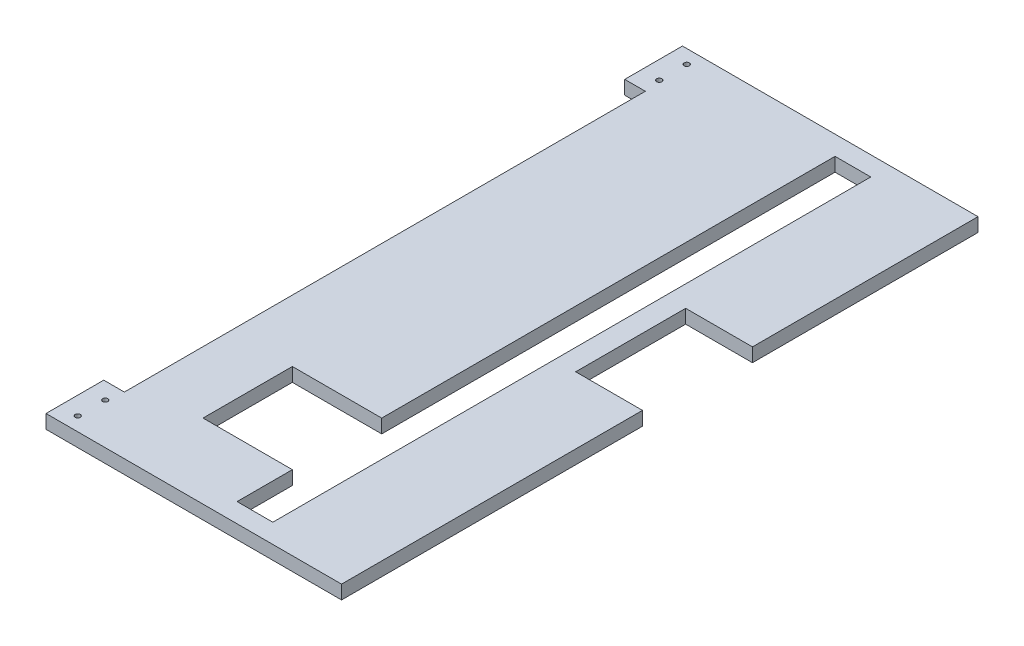
from build123d import *

# Parameters (mm, degrees)
SKETCH1_W           = 430
SKETCH1_H           = 463
BOSS_EXTRUDE1_DEPTH = 10
SKETCH2_W           = 48.6
SKETCH2_H           = 80
CUT_EXTRUDE1_DEPTH  = 10
SKETCH3_R           = 1.9
SKETCH3_W           = 26
SKETCH3_H           = 435
SKETCH3_W_2         = 22.64710068
SKETCH3_H_2         = 40
SKETCH3_W_3         = 30
SKETCH3_H_3         = 379
CUT_EXTRUDE2_DEPTH  = 10
SKETCH4_W           = 65
SKETCH4_H           = 65
CUT_EXTRUDE3_DEPTH  = 10
SKETCH5_W           = 636.219925535
SKETCH5_H           = 371.910781629
CUT_EXTRUDE5_DEPTH  = 255


with BuildPart() as part:
    # Sketch1 → Boss-Extrude1 (new body)
    with BuildSketch(Plane(origin=(0, 0, 0), x_dir=(1, 0, 0), z_dir=(0, 1, 0))):
        with Locations((6126.084066999, -8720.812377786)):
            Rectangle(SKETCH1_W, SKETCH1_H)
    extrude(amount=BOSS_EXTRUDE1_DEPTH)

    # Sketch2 → Cut-Extrude1 (cut)
    with BuildSketch(Plane(origin=(0, 10, 0), x_dir=(1, 0, 0), z_dir=(0, 1, 0))):
        with Locations((5935.384066999, -8693.059787309)):
            Rectangle(SKETCH2_W, SKETCH2_H)
        with Locations((6316.784066999, -8693.384418705)):
            Rectangle(SKETCH2_W, SKETCH2_H)
    extrude(amount=-CUT_EXTRUDE1_DEPTH, mode=Mode.SUBTRACT)

    # Sketch3 → Cut-Extrude2 (cut)
    with BuildSketch(Plane(origin=(0, 10, 0), x_dir=(1, 0, 0), z_dir=(0, 1, 0))):
        with Locations((6112.984066999, -8942.312377786)):
            Circle(SKETCH3_R)
        with Locations((6139.184066999, -8942.312377786)):
            Circle(SKETCH3_R)
        with Locations((6112.984066999, -8499.312377786)):
            Circle(SKETCH3_R)
        with Locations((6139.184066999, -8499.312377786)):
            Circle(SKETCH3_R)
        with Locations((6112.984066999, -8922.312377786)):
            Circle(SKETCH3_R)
        with Locations((6139.184066999, -8922.312377786)):
            Circle(SKETCH3_R)
        with Locations((6112.984066999, -8519.312377786)):
            Circle(SKETCH3_R)
        with Locations((6139.184066999, -8519.312377786)):
            Circle(SKETCH3_R)
        Polygon((5975.084066999, -8541.651929061), (5975.084066999, -8938.312377786), (6001.084066999, -8938.312377786), (6001.084066999, -8503.312377786), (5975.084066999, -8503.312377786), align=None)
        with Locations((6264.084066999, -8720.812377786)):
            Rectangle(SKETCH3_W, SKETCH3_H)
        with Locations((5957.807617339, -8549.312377786)):
            Rectangle(SKETCH3_W_2, SKETCH3_H_2)
        with Locations((6126.084066999, -8720.812377786)):
            Rectangle(SKETCH3_W_3, SKETCH3_H_3)
    extrude(amount=-CUT_EXTRUDE2_DEPTH, mode=Mode.SUBTRACT)

    # Sketch4 → Cut-Extrude3 (cut)
    with BuildSketch(Plane(origin=(0, 10, 0), x_dir=(1, 0, 0), z_dir=(0, 1, 0))):
        with Locations((6218.584066999, -8865.596518708)):
            Rectangle(SKETCH4_W, SKETCH4_H)
    extrude(amount=-CUT_EXTRUDE3_DEPTH, mode=Mode.SUBTRACT)

    # Sketch5 → Cut-Extrude5 (cut)
    with BuildSketch(Plane.ZY.offset(-6126.084067)):
        with Locations((8713.796116909, -43.108967652)):
            Rectangle(SKETCH5_W, SKETCH5_H)
    extrude(amount=CUT_EXTRUDE5_DEPTH, mode=Mode.SUBTRACT)


solid = part.part
